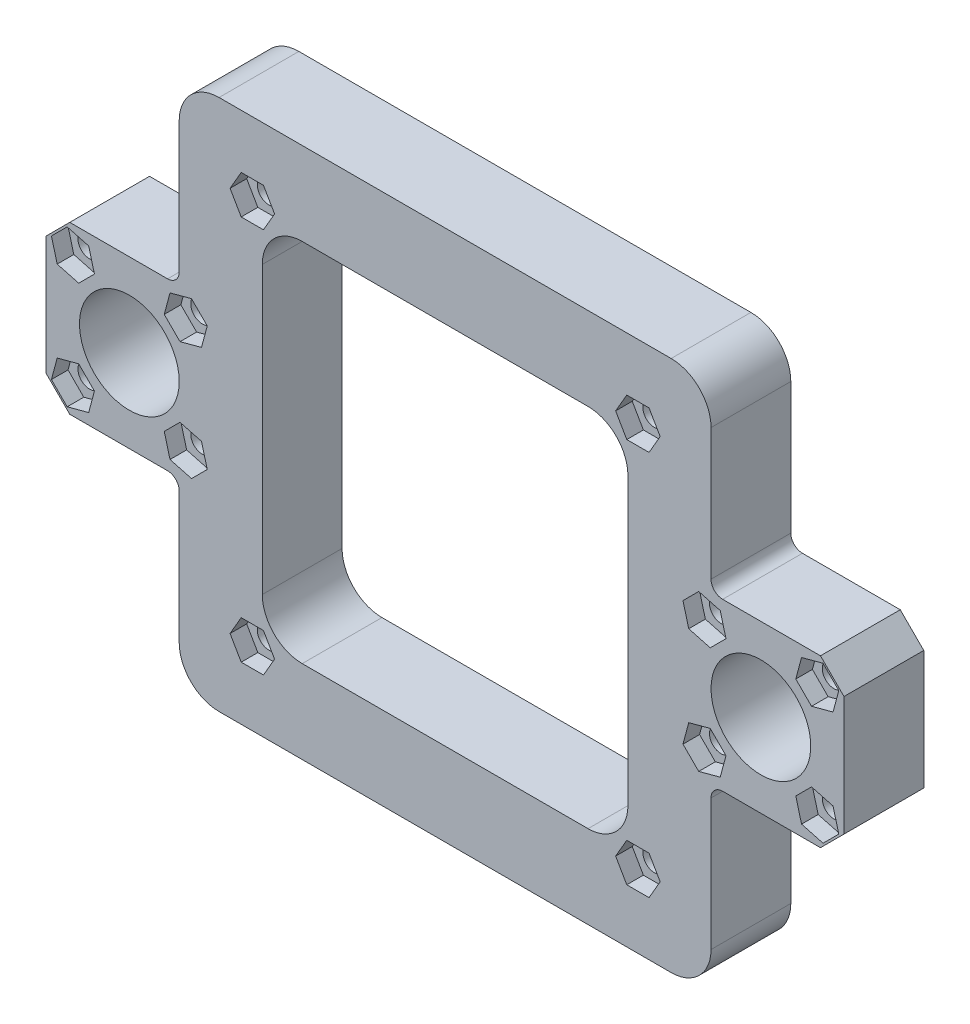
from build123d import *

# Parameters (mm, degrees)
SKETCH1_R               = 7.5
BOSS_EXTRUDE1_DEPTH     = 12
CUT_EXTRUDE3_DEPTH      = 74.10266753
CUT_EXTRUDE3_DEPTH_BACK = 74.10266753
SKETCH4_R               = 1.75
CUT_EXTRUDE1_DEPTH      = 74.10266753
CUT_EXTRUDE1_DEPTH_BACK = 74.10266753
CUT_EXTRUDE2_DEPTH      = 2.5
SKETCH7_R               = 1.75
CUT_EXTRUDE4_DEPTH      = 74.10266753
CUT_EXTRUDE5_DEPTH      = 2.5


with BuildPart() as part:
    # Sketch1 → Boss-Extrude1 (new body)
    with BuildSketch(Plane.XY):
        with BuildLine():
            Line((-56.464466094, 12.5), (-41.75, 12.5))
            ThreePointArc((-41.75, 12.5), (-40.512563133, 13.012563133), (-40, 14.25))
            Line((-40, 14.25), (-40, 34))
            ThreePointArc((-40, 34), (-38.242640687, 38.242640687), (-34, 40))
            Line((-34, 40), (34, 40))
            ThreePointArc((34, 40), (38.242640687, 38.242640687), (40, 34))
            Line((40, 34), (40, 14.25))
            ThreePointArc((40, 14.25), (40.512563133, 13.012563133), (41.75, 12.5))
            Line((41.75, 12.5), (56.464466094, 12.5))
            Line((56.464466094, 12.5), (60, 8.964466094))
            Line((60, 8.964466094), (60, -8.964466094))
            Line((60, -8.964466094), (56.464466094, -12.5))
            Line((56.464466094, -12.5), (41.75, -12.5))
            ThreePointArc((41.75, -12.5), (40.512563133, -13.012563133), (40, -14.25))
            Line((40, -14.25), (40, -34))
            ThreePointArc((40, -34), (38.242640687, -38.242640687), (34, -40))
            Line((34, -40), (-34, -40))
            ThreePointArc((-34, -40), (-38.242640687, -38.242640687), (-40, -34))
            Line((-40, -34), (-40, -14.25))
            ThreePointArc((-40, -14.25), (-40.512563133, -13.012563133), (-41.75, -12.5))
            Line((-41.75, -12.5), (-56.464466094, -12.5))
            Line((-56.464466094, -12.5), (-60, -8.964466094))
            Line((-60, -8.964466094), (-60, 8.964466094))
            Line((-60, 8.964466094), (-56.464466094, 12.5))
        make_face()
        with Locations((-47.5, 0)):
            Circle(SKETCH1_R, mode=Mode.SUBTRACT)
        with Locations((47.5, 0)):
            Circle(SKETCH1_R, mode=Mode.SUBTRACT)
    extrude(amount=BOSS_EXTRUDE1_DEPTH)

    # Sketch4 → Cut-Extrude3 (cut, two sides: drawn at the far end of the back side and taken through both)
    with BuildSketch(Plane.XY.offset(12).offset(-CUT_EXTRUDE3_DEPTH_BACK)):
        with Locations((55.985281374, 8.485281374)):
            Circle(SKETCH4_R)
        with Locations((55.985281374, -8.485281374)):
            Circle(SKETCH4_R)
        with Locations((39.014718626, -8.485281374)):
            Circle(SKETCH4_R)
        with Locations((39.014718626, 8.485281374)):
            Circle(SKETCH4_R)
        with Locations((-39.014718626, 8.485281374)):
            Circle(SKETCH4_R)
        with Locations((-39.014718626, -8.485281374)):
            Circle(SKETCH4_R)
        with Locations((-55.985281374, -8.485281374)):
            Circle(SKETCH4_R)
        with Locations((-55.985281374, 8.485281374)):
            Circle(SKETCH4_R)
    extrude(amount=CUT_EXTRUDE3_DEPTH + CUT_EXTRUDE3_DEPTH_BACK, mode=Mode.SUBTRACT)

    # Sketch2 → Cut-Extrude1 (cut, two sides: drawn at the far end of the back side and taken through both)
    with BuildSketch(Plane.XY.offset(12).offset(-CUT_EXTRUDE1_DEPTH_BACK)):
        with BuildLine():
            Line((-21.5, 27.5), (21.5, 27.5))
            ThreePointArc((21.5, 27.5), (25.742640687, 25.742640687), (27.5, 21.5))
            Line((27.5, 21.5), (27.5, -21.5))
            ThreePointArc((27.5, -21.5), (25.742640687, -25.742640687), (21.5, -27.5))
            Line((21.5, -27.5), (-21.5, -27.5))
            ThreePointArc((-21.5, -27.5), (-25.742640687, -25.742640687), (-27.5, -21.5))
            Line((-27.5, -21.5), (-27.5, 21.5))
            ThreePointArc((-27.5, 21.5), (-25.742640687, 25.742640687), (-21.5, 27.5))
        make_face()
    extrude(amount=CUT_EXTRUDE1_DEPTH + CUT_EXTRUDE1_DEPTH_BACK, mode=Mode.SUBTRACT)

    # Sketch3 → Cut-Extrude2 (cut)
    with BuildSketch(Plane.XY.offset(12)):
        Polygon((-55.118591751, 5.250751666), (-52.750751666, 7.618591751), (-53.61744129, 10.853121459), (-56.851970997, 11.719811082), (-59.219811082, 9.351970997), (-58.353121459, 6.11744129), align=None)
        Polygon((-42.249248334, 7.618591751), (-39.881408249, 5.250751666), (-36.646878541, 6.11744129), (-35.780188918, 9.351970997), (-38.148029003, 11.719811082), (-41.38255871, 10.853121459), align=None)
        Polygon((-39.881408249, -5.250751666), (-42.249248334, -7.618591751), (-41.38255871, -10.853121459), (-38.148029003, -11.719811082), (-35.780188918, -9.351970997), (-36.646878541, -6.11744129), align=None)
        Polygon((-52.750751666, -7.618591751), (-55.118591751, -5.250751666), (-58.353121459, -6.11744129), (-59.219811082, -9.351970997), (-56.851970997, -11.719811082), (-53.61744129, -10.853121459), align=None)
    cut_extrude2 = extrude(amount=-CUT_EXTRUDE2_DEPTH, mode=Mode.SUBTRACT)

    # Mirror1: Cut-Extrude2 across plane
    add(cut_extrude2.mirror(Plane(origin=(0, 0, 0), x_dir=(0, 0, 1), z_dir=(1, 0, 0))), mode=Mode.SUBTRACT)

    # Sketch7 → Cut-Extrude4 (cut, through all)
    with BuildSketch(Plane(origin=(0, 0, 0), x_dir=(-1, 0, 0), z_dir=(0, 0, -1))):
        with Locations((29, -29)):
            Circle(SKETCH7_R)
        with Locations((-29, 29)):
            Circle(SKETCH7_R)
        with Locations((-29, -29)):
            Circle(SKETCH7_R)
        with Locations((29, 29)):
            Circle(SKETCH7_R)
    extrude(amount=-CUT_EXTRUDE4_DEPTH, mode=Mode.SUBTRACT)

    # Sketch8 → Cut-Extrude5 (cut)
    with BuildSketch(Plane.XY.offset(12)):
        Polygon((-27.325684219, 26.1), (-25.651368439, 29), (-27.325684219, 31.9), (-30.674315781, 31.9), (-32.348631561, 29), (-30.674315781, 26.1), align=None)
        Polygon((-27.325684219, -31.9), (-25.651368439, -29), (-27.325684219, -26.1), (-30.674315781, -26.1), (-32.348631561, -29), (-30.674315781, -31.9), align=None)
        Polygon((30.674315781, -31.9), (32.348631561, -29), (30.674315781, -26.1), (27.325684219, -26.1), (25.651368439, -29), (27.325684219, -31.9), align=None)
        Polygon((30.674315781, 26.1), (32.348631561, 29), (30.674315781, 31.9), (27.325684219, 31.9), (25.651368439, 29), (27.325684219, 26.1), align=None)
    extrude(amount=-CUT_EXTRUDE5_DEPTH, mode=Mode.SUBTRACT)


solid = part.part
